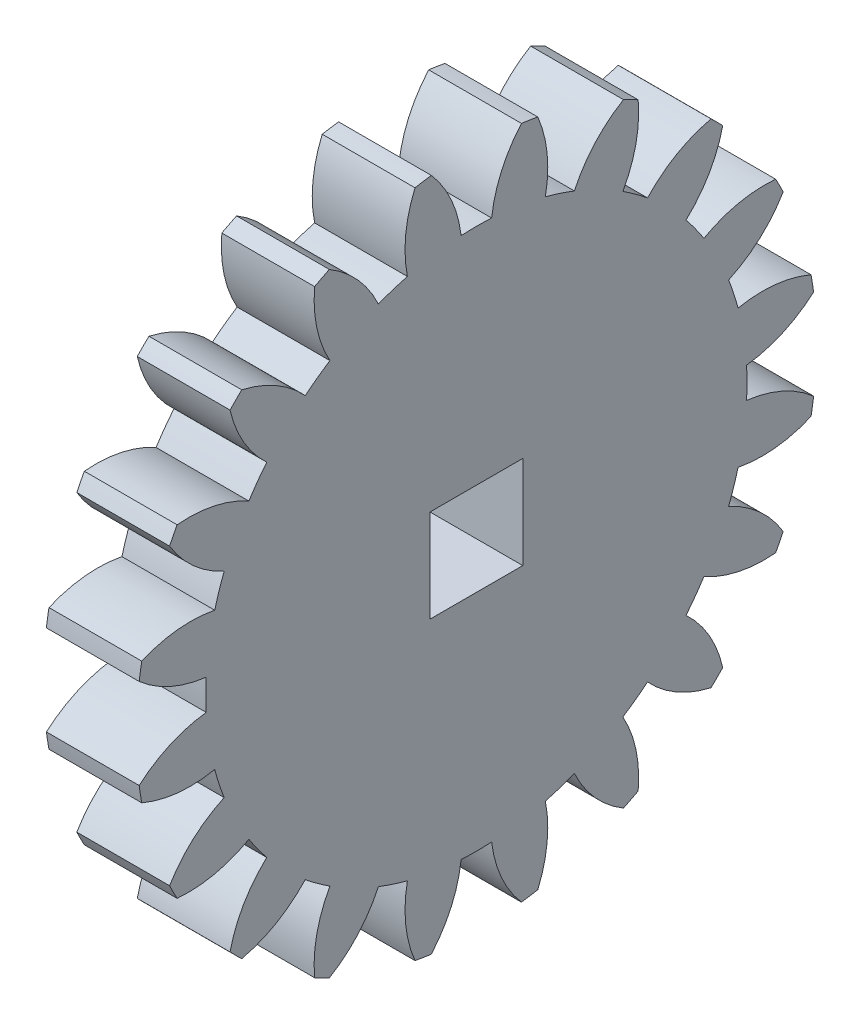
from build123d import *

# Parameters (mm, degrees)
BASPROSKE_W           = 6
BASPROSKE_H           = 22
TOOTHCUT_DEPTH        = 32.685959036
TEETHCUTS_COUNT       = 20
TEETHCUTS_ANGLE       = 342
BORSKE_R              = 0.5
BORE_DEPTH            = 50.0000508
CORTAR_EXTRUIR1_DEPTH = 10


with BuildPart() as part:
    # BasProSke → Base-Revolve (revolve)
    with BuildSketch(Plane(origin=(0, 0, 0), x_dir=(1, 0, 0), z_dir=(0, 1, 0))):
        with Locations((3, 11)):
            Rectangle(BASPROSKE_W, BASPROSKE_H)
    revolve(axis=Axis((-10, 0, 0), (1, 0, 0)))

    # TooCutSke → ToothCut (cut, through all)
    with BuildSketch(Plane(origin=(0, 0, 0), x_dir=(0, 0, -1), z_dir=(1, 0, 0))):
        with BuildLine():
            ThreePointArc((0.986171591, 17.471189616), (0, 17.499), (-0.986171591, 17.471189616))
            ThreePointArc((-0.986171591, 17.471189616), (-1.626916196, 19.798789858), (-2.932850173, 21.829260982))
            ThreePointArc((-2.932850173, 21.829260982), (0, 22.0254), (2.932850173, 21.829260982))
            ThreePointArc((2.932850173, 21.829260982), (1.626916196, 19.798789858), (0.986171591, 17.471189616))
        make_face()
    toothcut = extrude(amount=TOOTHCUT_DEPTH, mode=Mode.SUBTRACT)

    # TeethCuts: ToothCut ×20 about axis
    teethcuts_axis = Axis((-10, 0, 0), (1, 0, 0))
    for i in range(1, TEETHCUTS_COUNT):
        add(toothcut.rotate(teethcuts_axis, i * TEETHCUTS_ANGLE / (TEETHCUTS_COUNT - 1)), mode=Mode.SUBTRACT)

    # BorSke → Bore (cut, symmetric)
    with BuildSketch(Plane(origin=(0, 0, 0), x_dir=(0, 0, -1), z_dir=(1, 0, 0))):
        Circle(BORSKE_R)
    extrude(amount=BORE_DEPTH, both=True, mode=Mode.SUBTRACT)

    # Croquis1 → Cortar-Extruir1 (cut)
    with BuildSketch(Plane(origin=(6, 0, 0), x_dir=(0, 0, -1), z_dir=(1, 0, 0))):
        Polygon((0, 3), (-3, 3), (-3, -3), (3, -3), (3, 3), align=None)
    extrude(amount=-CORTAR_EXTRUIR1_DEPTH, mode=Mode.SUBTRACT)


solid = part.part
